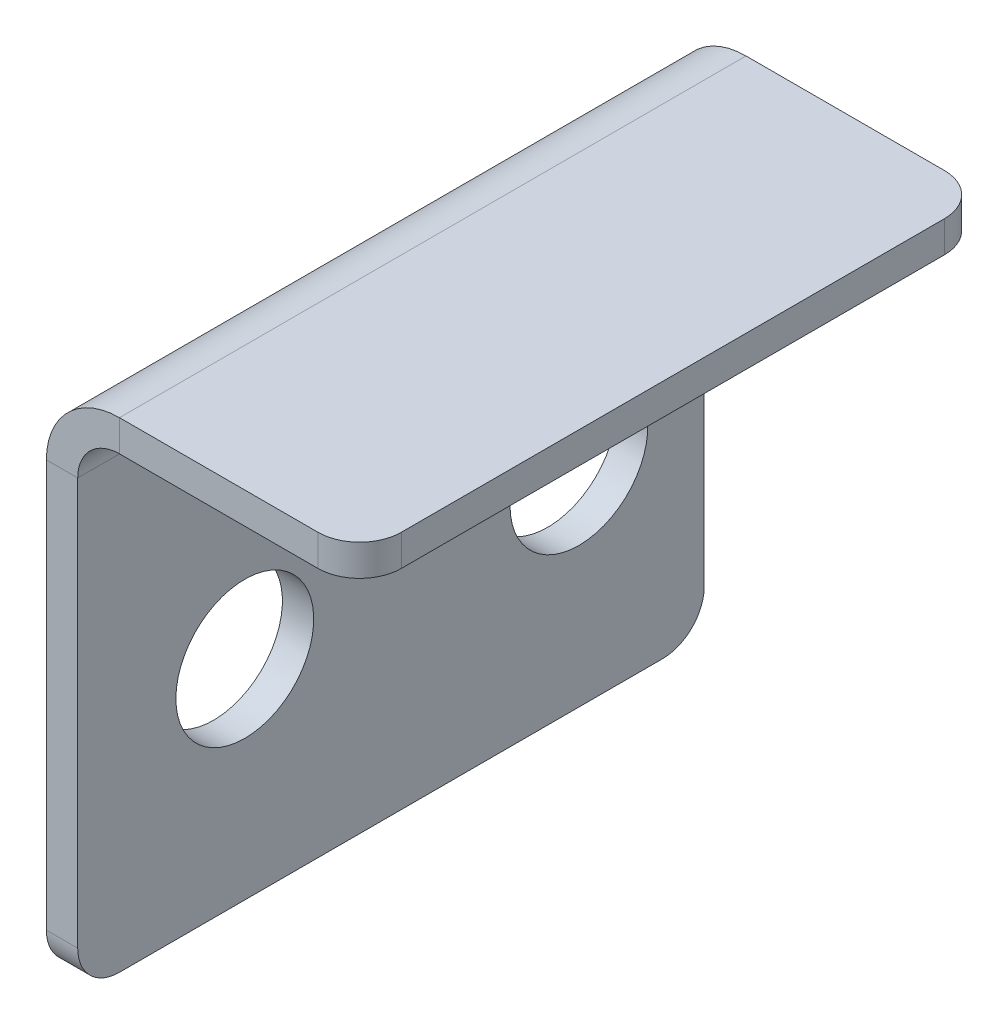
from build123d import *

# Parameters (mm, degrees)
ODGI_CIE_BAZOWE1_DEPTH  = 15
OTW_R_POD_RUB_M61_D     = 6.6
OTW_R_POD_RUB_M61_DEPTH = 10
OTW_R_POD_RUB_M61_TIP   = 1.982840043
ZAOKR_GLENIE1_R         = 2


# Sheet-metal steps are written as plain solids
with BuildPart() as part:
    # Szkic1 → Odgięcie bazowe1 (new, symmetric)
    with BuildSketch(Plane.XY):
        with BuildLine():
            Line((15, 0), (3.5, 0))
            ThreePointArc((3.5, 0), (1.025126266, -1.025126266), (0, -3.5))
            Line((0, -3.5), (0, -25))
            Line((0, -25), (1.5, -25))
            Line((1.5, -25), (1.5, -3.5))
            ThreePointArc((1.5, -3.5), (2.085786438, -2.085786438), (3.5, -1.5))
            Line((3.5, -1.5), (15, -1.5))
            Line((15, -1.5), (15, 0))
        make_face()
    extrude(amount=ODGI_CIE_BAZOWE1_DEPTH, both=True)

    # Otwór pod śrubę M61
    with Locations(Plane.ZY):
        with Locations((-9, -15), (7, -15)):
            Hole(OTW_R_POD_RUB_M61_D / 2, depth=OTW_R_POD_RUB_M61_DEPTH)
            with Locations((0, 0, -(OTW_R_POD_RUB_M61_DEPTH + OTW_R_POD_RUB_M61_TIP / 2))):  # 118° drill point
                Cone(0, OTW_R_POD_RUB_M61_D / 2, OTW_R_POD_RUB_M61_TIP, mode=Mode.SUBTRACT)

    # Zaokrąglenie1
    zaokr_glenie1_edges = [part.edges().sort_by_distance(p)[0] for p in [
        (0.75, -25, 15),
        (0.75, -25, -15),
        (15, -0.75, 15),
        (15, -0.75, -15),
    ]]
    fillet(zaokr_glenie1_edges, radius=ZAOKR_GLENIE1_R)


solid = part.part
